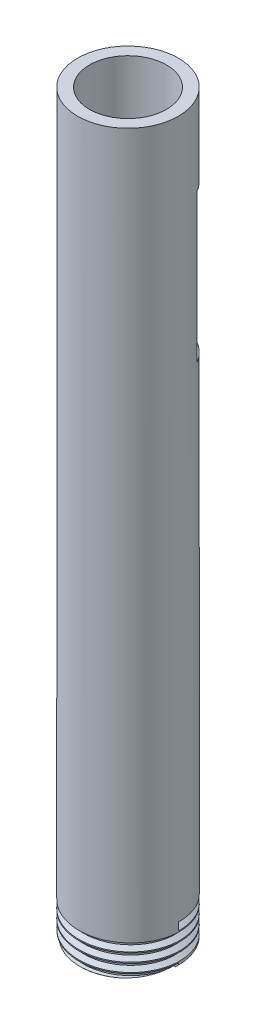
from build123d import *

# Parameters (mm, degrees)
SKETCH1_R           = 17
SKETCH1_R_2         = 13
BOSS_EXTRUDE1_DEPTH = 124.5
CUT_EXTRUDE2_START  = 10
CUT_EXTRUDE2_DEPTH  = 50
THREAD1_PITCH       = 3
CHAMFER2_SIZE       = 1


with BuildPart() as part:
    # Sketch1 → Boss-Extrude1 (new, symmetric)
    with BuildSketch(Plane(origin=(0, 0, 0), x_dir=(1, 0, 0), z_dir=(0, 1, 0))):
        with Locations(Location((0, 0, 0), (0, 0, 270))):
            Circle(SKETCH1_R)
        with Locations(Location((0, 0, 0), (0, 0, 270))):
            Circle(SKETCH1_R_2, mode=Mode.SUBTRACT)
    extrude(amount=BOSS_EXTRUDE1_DEPTH, both=True)

    # Sketch3 → Cut-Extrude2 (cut)
    with BuildSketch(Plane(origin=(0, 87, 0), x_dir=(1, 0, 0), z_dir=(0, 1, 0)).offset(CUT_EXTRUDE2_START)):
        with BuildLine():
            Line((0, 0), (14.722431864, 8.5))
            ThreePointArc((14.722431864, 8.5), (0, 17), (-14.722431864, 8.5))
            Line((-14.722431864, 8.5), (0, 0))
        make_face()
    extrude(amount=-CUT_EXTRUDE2_DEPTH, mode=Mode.SUBTRACT)

    # Thread1: the profile of Thread Profile1 profile screwed along a left-hand helix of 4 turns, 10 arcs to a turn; built about Z, then put on its axis
    thread1_z = Axis((0, 0, 0), (0, 0, 1))
    thread1_corners = [(17.0003, 0, -0.000173205), (17.0003, 0, 2.625173197), (15.376202375, 0, 1.687499996), (15.376202375, 0, 0.937499996)]
    with BuildLine(mode=Mode.PRIVATE) as thread1_profile:
        Line(thread1_corners[0], thread1_corners[1])
        Line(thread1_corners[1], thread1_corners[2])
        Line(thread1_corners[2], thread1_corners[3])
        Line(thread1_corners[3], thread1_corners[0])
    thread1_cap = Face(thread1_profile.wire())
    thread1_turn_angles = [0, -18, -36, -54, -72, -90, -108, -126, -144, -162, -180, -198, -216, -234, -252, -270, -288, -306, -324, -342, -360]
    thread1_turn_weights = [1, 0.9510565162951535, 1, 0.9510565162951535, 1, 0.9510565162951535, 1, 0.9510565162951535, 1, 0.9510565162951535, 1, 0.9510565162951535, 1, 0.9510565162951535, 1, 0.9510565162951535, 1, 0.9510565162951535, 1, 0.9510565162951535, 1]
    thread1_turn_rails = [Edge.make_bspline([Vector(p[0], p[1], 0).rotate(thread1_z, thread1_turn_angles[k]) / thread1_turn_weights[k] + Vector(0, 0, p[2] + -THREAD1_PITCH * thread1_turn_angles[k] / 360) for k in range(21)], [0, 0, 0, 1, 1, 2, 2, 3, 3, 4, 4, 5, 5, 6, 6, 7, 7, 8, 8, 9, 9, 10, 10, 10], 2, thread1_turn_weights) for p in thread1_corners]
    thread1_turn_sides = [Face.make_surface_from_curves(thread1_turn_rails[p[0]], thread1_turn_rails[p[1]]) for p in [(0, 1), (1, 2), (2, 3), (3, 0)]]
    thread1 = Plane(origin=(0, -125.5, 0), x_dir=(1, 0, 0), z_dir=(0, 1, 0)) * Solid(Shell([*[p.moved(Location((0, 0, THREAD1_PITCH * i))) for i in range(4) for p in thread1_turn_sides], thread1_cap, thread1_cap.rotate(thread1_z, -1440).moved(Location((0, 0, -THREAD1_PITCH * -1440 / 360)))]))
    add(thread1, mode=Mode.SUBTRACT)

    # Chamfer2
    chamfer2_edges = [part.edges().sort_by_distance(p)[0] for p in [
        (-8.48872702, -124.5, -14.728934571),
    ]]
    chamfer(chamfer2_edges, length=CHAMFER2_SIZE)


solid = part.part
